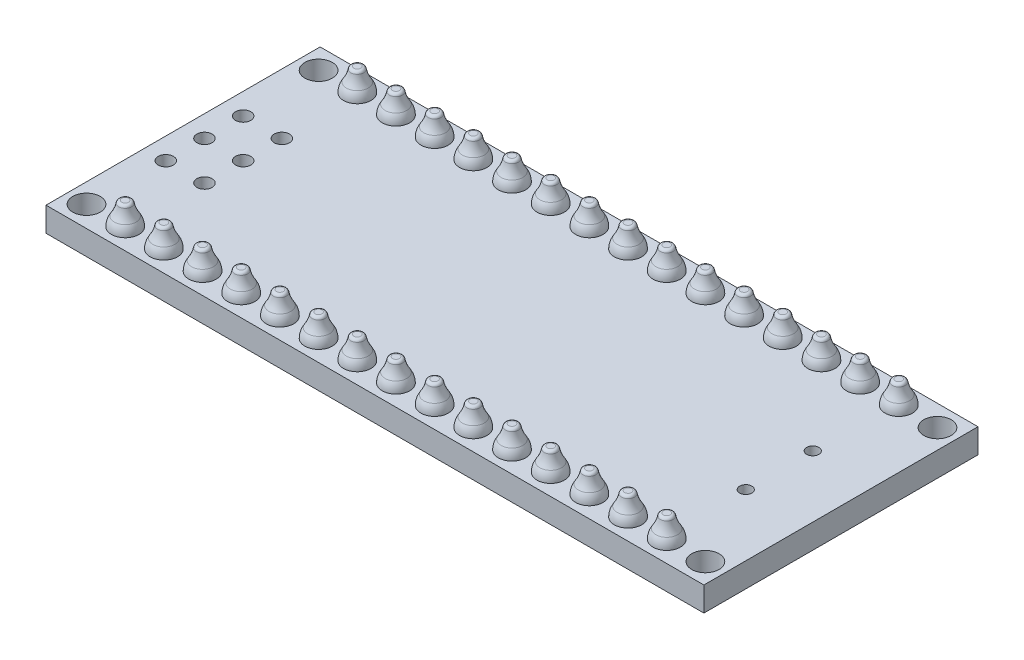
from build123d import *

# Parameters (mm, degrees)
SKETCH1_W            = 43.2
SKETCH1_H            = 18
BOSS_EXTRUDE2_DEPTH  = 1.6
SKETCH2_R            = 0.45
CUT_EXTRUDE2_DEPTH   = 1.6
LPATTERN1_COUNT      = 15
LPATTERN1_PITCH      = 2.54
SKETCH3_R            = 0.5
CUT_EXTRUDE4_DEPTH   = 1.6
SKETCH4_R            = 0.9
CUT_EXTRUDE5_DEPTH   = 1.6
LPATTERN2_COUNT      = 2
LPATTERN2_PITCH      = 15.24
LPATTERN2_COUNT_DIR2 = 15
LPATTERN2_PITCH_DIR2 = 2.54
LPATTERN3_COUNT      = 2
LPATTERN3_PITCH      = 2.54
LPATTERN3_COUNT_DIR2 = 3
LPATTERN3_PITCH_DIR2 = 2.54
SKETCH9_R            = 0.4
CUT_EXTRUDE6_DEPTH   = 10


with BuildPart() as part:
    # Sketch1 → Boss-Extrude2 (new body)
    with BuildSketch(Plane(origin=(0, 0, 0), x_dir=(1, 0, 0), z_dir=(0, 1, 0))):
        with Locations((17.78, 7.62)):
            Rectangle(SKETCH1_W, SKETCH1_H)
    extrude(amount=BOSS_EXTRUDE2_DEPTH)

    # Sketch2 → Cut-Extrude2 (cut)
    with BuildSketch(Plane(origin=(0, 0, 0), x_dir=(1, 0, 0), z_dir=(0, 1, 0))):
        Circle(SKETCH2_R)
        with Locations((0, 15.24)):
            Circle(SKETCH2_R)
    cut_extrude2 = extrude(amount=CUT_EXTRUDE2_DEPTH, mode=Mode.SUBTRACT)

    # LPattern1: Cut-Extrude2 ×15
    with Locations(*[(i * LPATTERN1_PITCH, 0, 0) for i in range(1, LPATTERN1_COUNT)]):
        add(cut_extrude2, mode=Mode.SUBTRACT)

    # Sketch3 → Cut-Extrude4 (cut)
    with BuildSketch(Plane(origin=(0, 0, 0), x_dir=(1, 0, 0), z_dir=(0, 1, 0))):
        with Locations((0.127, 10.16)):
            Circle(SKETCH3_R)
        with Locations((-2.413, 10.16)):
            Circle(SKETCH3_R)
        with Locations((-2.413, 7.62)):
            Circle(SKETCH3_R)
        with Locations((-2.413, 5.08)):
            Circle(SKETCH3_R)
        with Locations((0.127, 5.08)):
            Circle(SKETCH3_R)
        with Locations((0.127, 7.62)):
            Circle(SKETCH3_R)
    extrude(amount=CUT_EXTRUDE4_DEPTH, mode=Mode.SUBTRACT)

    # Sketch4 → Cut-Extrude5 (cut)
    with BuildSketch(Plane(origin=(0, 0, 0), x_dir=(1, 0, 0), z_dir=(0, 1, 0))):
        with Locations((38.1, 15.24)):
            Circle(SKETCH4_R)
        with Locations((38.1, 0)):
            Circle(SKETCH4_R)
        with Locations((-2.54, 0)):
            Circle(SKETCH4_R)
        with Locations((-2.54, 15.24)):
            Circle(SKETCH4_R)
    extrude(amount=CUT_EXTRUDE5_DEPTH, mode=Mode.SUBTRACT)

    # Sketch6 → Revolve1 (revolve)
    with BuildSketch(Plane(origin=(0, 0, 0), x_dir=(0, 0, -1), z_dir=(1, 0, 0))):
        with BuildLine():
            Line((0, 1.6), (0.9, 1.6))
            ThreePointArc((0.9, 1.6), (0.852442497, 1.91994498), (0.713882199, 2.212224898))
            ThreePointArc((0.713882199, 2.212224898), (0.530499248, 2.558589224), (0.422081551, 2.93520993))
            ThreePointArc((0.422081551, 2.93520993), (0.353575878, 3.053365554), (0.225205293, 3.1))
            Line((0.225205293, 3.1), (0, 3.1))
            Line((0, 3.1), (0, 1.6))
        make_face()
    revolve1 = revolve(axis=Axis((0, 1.372239532, 0), (0, 1, 0)))

    # LPattern2: Revolve1 2 × 15
    with Locations(*[(j * LPATTERN2_PITCH_DIR2, 0, -i * LPATTERN2_PITCH) for i in range(LPATTERN2_COUNT) for j in range(LPATTERN2_COUNT_DIR2) if (i, j) != (0, 0)]):
        add(revolve1)

    # Sketch7 → Revolve2 (revolve)
    with BuildSketch(Plane.XY.offset(-5.08)):
        with BuildLine():
            Line((0.127, 0), (1.027, 0))
            ThreePointArc((1.027, 0), (0.970551628, -0.347850543), (0.807, -0.66))
            ThreePointArc((0.807, -0.66), (0.629174555, -0.974977034), (0.537980562, -1.325))
            ThreePointArc((0.537980562, -1.325), (0.471836779, -1.45), (0.339549213, -1.5))
            Line((0.339549213, -1.5), (0.127, -1.5))
            Line((0.127, -1.5), (0.127, 0))
        make_face()
    revolve2 = revolve(axis=Axis((0.127, 3.888986093, -5.08), (0, -1, 0)))

    # LPattern3: Revolve2 2 × 3
    with Locations(*[(-i * LPATTERN3_PITCH, 0, -j * LPATTERN3_PITCH_DIR2) for i in range(LPATTERN3_COUNT) for j in range(LPATTERN3_COUNT_DIR2) if (i, j) != (0, 0)]):
        add(revolve2)

    # Sketch9 → Cut-Extrude6 (cut)
    with BuildSketch(Plane(origin=(0, 0, 0), x_dir=(1, 0, 0), z_dir=(0, 1, 0))):
        with Locations((35.33, 5.42)):
            Circle(SKETCH9_R)
        with Locations((35.33, 9.82)):
            Circle(SKETCH9_R)
    extrude(amount=CUT_EXTRUDE6_DEPTH, mode=Mode.SUBTRACT)


solid = part.part
